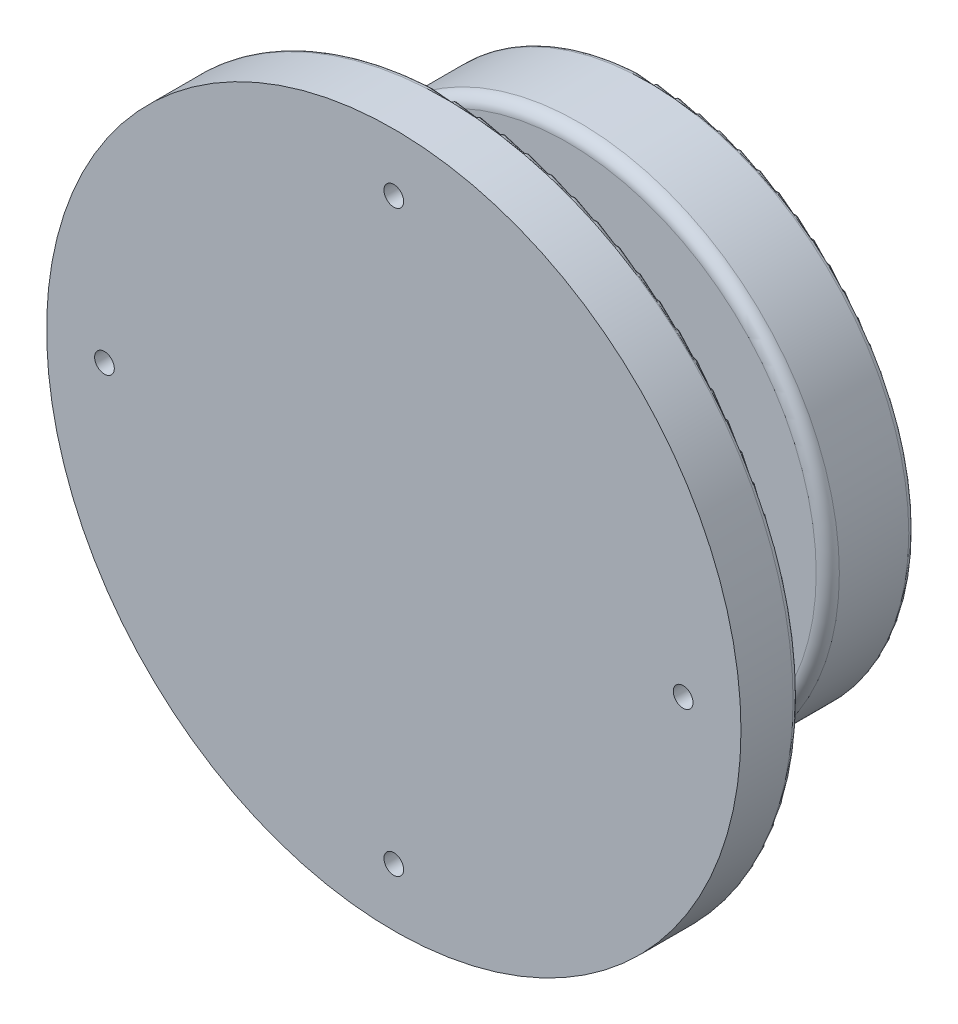
from build123d import *

# Parameters (mm, degrees)
ESQUISSE1_R                                = 45
BOSS_EXTRU_1_DEPTH                         = 15
ESQUISSE3_R                                = 10
BOSS_EXTRU_2_DEPTH                         = 20
ESQUISSE4_R                                = 60
BOSS_EXTRU_3_DEPTH                         = 10
CONG_1_R                                   = 2
CONG_2_R                                   = 1
CONG_3_R                                   = 1
TROU_TARAUD_M31_D                          = 2.5
TROU_TARAUD_M31_DEPTH                      = 12.5
TROU_TARAUD_M31_TIP                        = 0.751075774
CHAMBRAGE_POUR_VIS_T_TE_HEXAGONALE_2_COUNT = 2
CHAMBRAGE_POUR_VIS_T_TE_HEXAGONALE_2_PITCH = 70.710678119
CHAMBRAGE_POUR_VIS_T_TE_HEXAGONALE_3_COUNT = 2
CHAMBRAGE_POUR_VIS_T_TE_HEXAGONALE_3_PITCH = 100
CHAMBRAGE_POUR_VIS_T_TE_HEXAGONALE_4_COUNT = 2
CHAMBRAGE_POUR_VIS_T_TE_HEXAGONALE_4_PITCH = 70.710678119


with BuildPart() as part:
    # Esquisse1 → Boss.-Extru.1 (new body)
    with BuildSketch(Plane.XY):
        Circle(ESQUISSE1_R)
    extrude(amount=BOSS_EXTRU_1_DEPTH)

    # Esquisse3 → Boss.-Extru.2 (add)
    with BuildSketch(Plane.XY.offset(15)):
        Circle(ESQUISSE3_R)
    extrude(amount=BOSS_EXTRU_2_DEPTH)

    # Esquisse4 → Boss.-Extru.3 (add)
    with BuildSketch(Plane.XY.offset(35)):
        Circle(ESQUISSE4_R)
    extrude(amount=BOSS_EXTRU_3_DEPTH)

    # Congé1
    cong_1_edges = [part.edges().sort_by_distance(p)[0] for p in [
        (-45, 0, 15),
    ]]
    fillet(cong_1_edges, radius=CONG_1_R)

    # Congé2
    cong_2_edges = [part.edges().sort_by_distance(p)[0] for p in [
        (-60, 0, 35),
    ]]
    fillet(cong_2_edges, radius=CONG_2_R)

    # Congé3
    cong_3_edges = [part.edges().sort_by_distance(p)[0] for p in [
        (-45, 0, 0),
    ]]
    fillet(cong_3_edges, radius=CONG_3_R)

    # Trou taraudé M31
    with Locations(Plane(origin=(-7, 0, 0), x_dir=(-1, 0, 0), z_dir=(0, 0, -1))):
        with Locations((0, 0), (-14, 0)):
            Hole(TROU_TARAUD_M31_D / 2, depth=TROU_TARAUD_M31_DEPTH)
            with Locations((0, 0, -(TROU_TARAUD_M31_DEPTH + TROU_TARAUD_M31_TIP / 2))):  # 118° drill point
                Cone(0, TROU_TARAUD_M31_D / 2, TROU_TARAUD_M31_TIP, mode=Mode.SUBTRACT)

    # Esquisse9 → Chambrage pour vis à tête hexagonale M31 (revolve, cut)
    with BuildSketch(Plane(origin=(0, 50, 35), x_dir=(0, 1, 0), z_dir=(1, 0, 0))):
        Polygon((0, 0), (0, 10), (1.7, 10), (1.7, 2), (4.6755, 2), (4.6755, 0.025), (4.7005, 0), align=None)
    chambrage_pour_vis_t_te_hexagonale_m31 = revolve(axis=Axis((0, 50, 28.65), (0, 0, 1)), mode=Mode.SUBTRACT)

    # Chambrage pour vis _ t_te hexagonale 2: Chambrage pour vis à tête hexagonale M31 ×2
    with Locations(*[Vector(0.7071067811865476, -0.7071067811865476, 0) * (i * CHAMBRAGE_POUR_VIS_T_TE_HEXAGONALE_2_PITCH) for i in range(1, CHAMBRAGE_POUR_VIS_T_TE_HEXAGONALE_2_COUNT)]):
        add(chambrage_pour_vis_t_te_hexagonale_m31, mode=Mode.SUBTRACT)

    # Chambrage pour vis _ t_te hexagonale 3: Chambrage pour vis à tête hexagonale M31 ×2
    with Locations(*[(0, -i * CHAMBRAGE_POUR_VIS_T_TE_HEXAGONALE_3_PITCH, 0) for i in range(1, CHAMBRAGE_POUR_VIS_T_TE_HEXAGONALE_3_COUNT)]):
        add(chambrage_pour_vis_t_te_hexagonale_m31, mode=Mode.SUBTRACT)

    # Chambrage pour vis _ t_te hexagonale 4: Chambrage pour vis à tête hexagonale M31 ×2
    with Locations(*[Vector(-0.7071067811865476, -0.7071067811865476, 0) * (i * CHAMBRAGE_POUR_VIS_T_TE_HEXAGONALE_4_PITCH) for i in range(1, CHAMBRAGE_POUR_VIS_T_TE_HEXAGONALE_4_COUNT)]):
        add(chambrage_pour_vis_t_te_hexagonale_m31, mode=Mode.SUBTRACT)


solid = part.part
